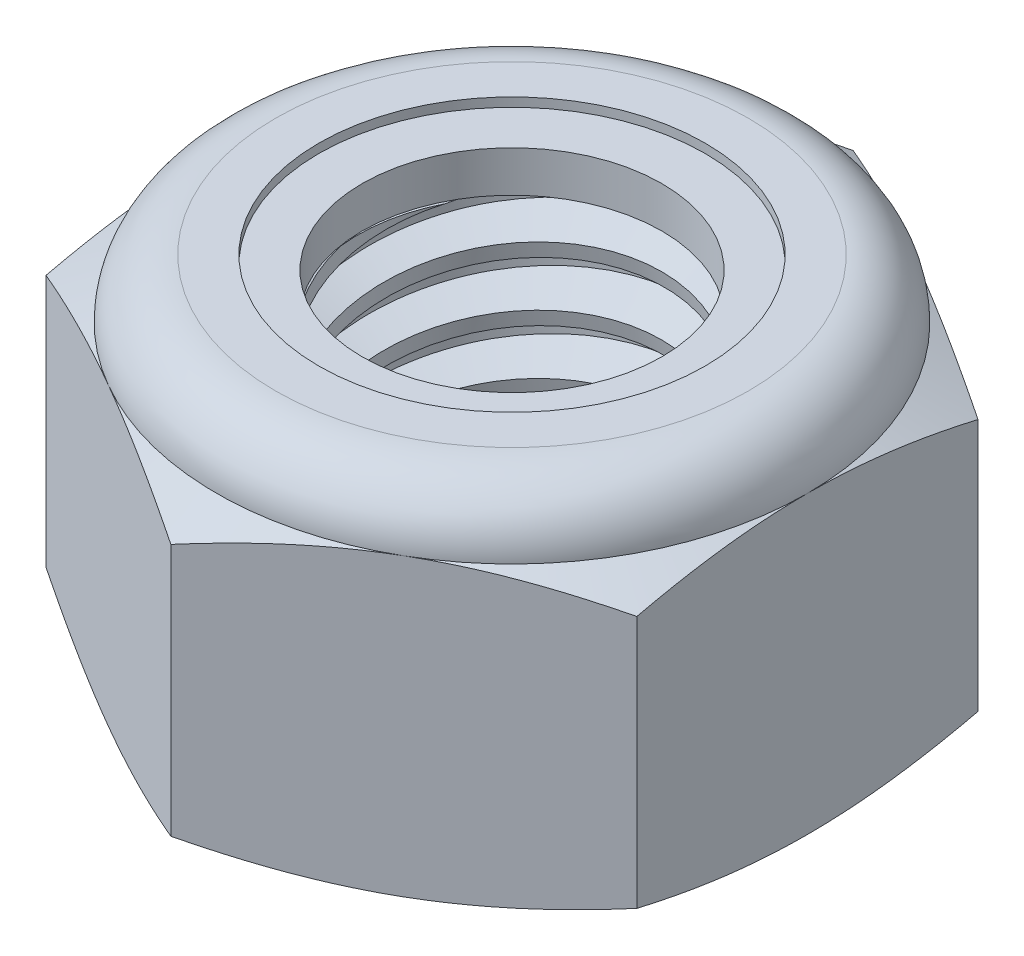
from build123d import *

# Parameters (mm, degrees)
EXTRUDE1_DEPTH       = 6
SKETCH2_W            = 3
SKETCH2_H            = 6
LPATTERN1_COUNT      = 6
LPATTERN1_PITCH      = 1
LPATTERN1_COUNT_DIR2 = 2
LPATTERN1_PITCH_DIR2 = 1


with BuildPart() as part:
    # Sketch1 → Extrude1 (new body)
    with BuildSketch(Plane(origin=(0, 0, 0), x_dir=(1, 0, 0), z_dir=(0, 1, 0))):
        Polygon((0, 5.773502692), (-5, 2.886751346), (-5, -2.886751346), (0, -5.773502692), (5, -2.886751346), (5, 2.886751346), align=None)
    extrude(amount=EXTRUDE1_DEPTH)

    # Sketch4 → Cut-Revolve2 (revolve, cut)
    with BuildSketch(Plane(origin=(0, 0, 0), x_dir=(0, 0, -1), z_dir=(1, 0, 0))):
        Polygon((0, 6), (3, 6), (2.538023184, 5.784576673), (2.538023184, 0.215423327), (3, 0), (0, 0), align=None)
    revolve(axis=Axis((0, 6, 0), (0, 1, 0)), mode=Mode.SUBTRACT)


with BuildPart() as body_2:
    # Sketch2 → Revolve1 (revolve)
    with BuildSketch(Plane(origin=(0, 0, 0), x_dir=(0, 0, -1), z_dir=(1, 0, 0))):
        with Locations((1.5, 3)):
            Rectangle(SKETCH2_W, SKETCH2_H)
    revolve(axis=Axis((0, -3, 0), (0, 1, 0)))

    # Sketch3 → Cut-Revolve1 (revolve, cut)
    with BuildSketch(Plane(origin=(0, 0, 0), x_dir=(0, 0, -1), z_dir=(1, 0, 0))):
        Polygon((3.020549873, 5.87670076), (3.164398987, 5.013606076), (2.579122931, 5.232870615), (2.538023184, 5.479469096), align=None)
    cut_revolve1 = revolve(axis=Axis((0, 6, 0.178376498), (0, -0.9863939238321437, -0.16439898730535746)), mode=Mode.SUBTRACT)

    # LPattern1: Cut-Revolve1 6 × 2
    with Locations(*[Vector(0, -1, 0) * (i * LPATTERN1_PITCH) + Vector(0, 1, 0) * (j * LPATTERN1_PITCH_DIR2) for i in range(LPATTERN1_COUNT) for j in range(LPATTERN1_COUNT_DIR2) if (i, j) != (0, 0)]):
        add(cut_revolve1, mode=Mode.SUBTRACT)


with BuildPart() as part_1:
    add(part.part)

    # Combine1: cut body 2
    add(body_2.part, mode=Mode.SUBTRACT)

    # Sketch5 → Cut-Revolve3 (revolve, cut)
    with BuildSketch(Plane(origin=(0, 0, 0), x_dir=(0, 0, -1), z_dir=(1, 0, 0))):
        with BuildLine():
            Line((0, 0), (5, 0))
            Line((5, 0), (5.773502692, 0.360690229))
            Line((5.773502692, 0.360690229), (5.773502692, 4.639309771))
            Line((5.773502692, 4.639309771), (5, 5))
            ThreePointArc((5, 5), (4.707106781, 5.707106781), (4, 6))
            Line((4, 6), (4, 7.27))
            Line((4, 7.27), (7.043502692, 7.27))
            Line((7.043502692, 7.27), (7.043502692, -1.27))
            Line((7.043502692, -1.27), (0, -1.27))
            Line((0, -1.27), (0, 0))
        make_face()
    revolve(axis=Axis((0, 0, 0), (0, 1, 0)), mode=Mode.SUBTRACT)

    # Sketch6 → Cut-Revolve4 (revolve, cut)
    with BuildSketch(Plane(origin=(0, 0, 0), x_dir=(0, 0, -1), z_dir=(1, 0, 0))):
        with BuildLine():
            Line((0, 5), (4.8476, 5))
            ThreePointArc((4.8476, 5), (4.599343708, 5.599343708), (4, 5.8476))
            Line((4, 5.8476), (3.269011592, 5.8476))
            Line((3.269011592, 5.8476), (3.269011592, 7.27))
            Line((3.269011592, 7.27), (0, 7.27))
            Line((0, 7.27), (0, 5))
        make_face()
    revolve(axis=Axis((0, 7.27, 0), (0, 1, 0)), mode=Mode.SUBTRACT)


with BuildPart() as body_2_2:
    # Sketch7 → Revolve2 (revolve)
    with BuildSketch(Plane(origin=(0, 0, 0), x_dir=(0, 0, -1), z_dir=(1, 0, 0))):
        with BuildLine():
            Line((2.538023184, 5.0762), (4.767627201, 5.0762))
            ThreePointArc((4.767627201, 5.0762), (4.51782105, 5.57176859), (4, 5.7714))
            Line((4, 5.7714), (2.538023184, 5.7714))
            Line((2.538023184, 5.7714), (2.538023184, 5.0762))
        make_face()
    revolve(axis=Axis((0, 5.0762, 0), (0, 1, 0)))


solid = Compound([part_1.part, body_2_2.part])
